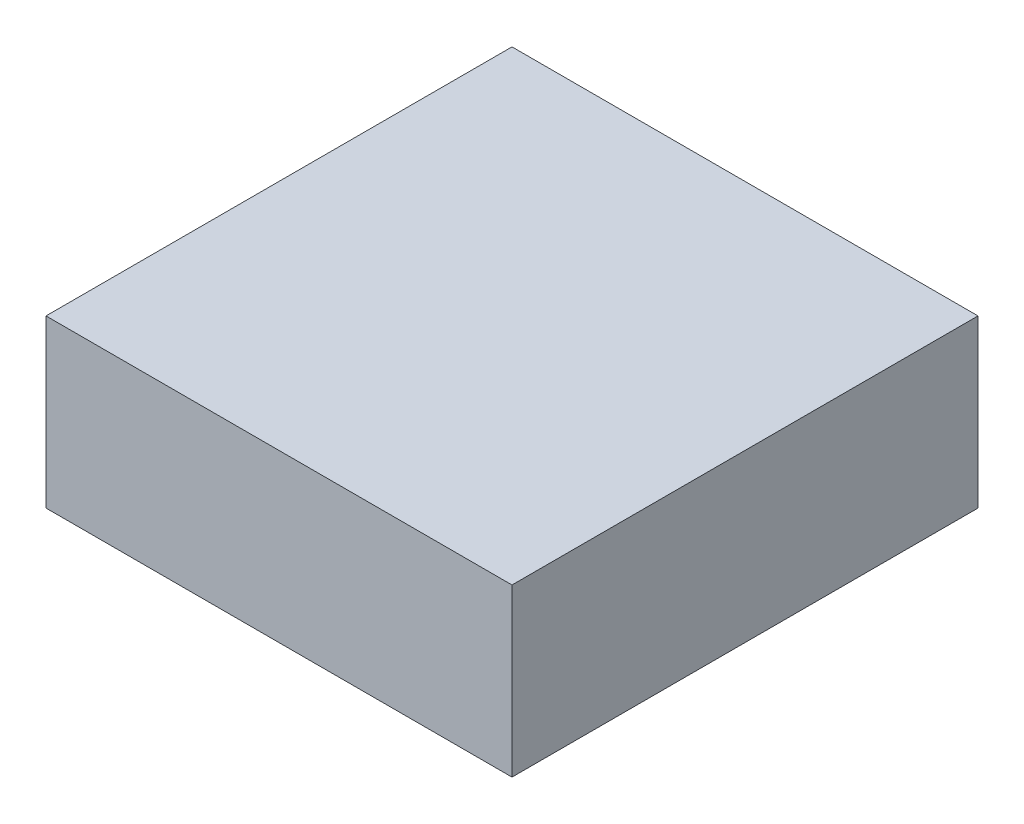
from build123d import *

# Parameters (mm, degrees)
CROQUIS1_W              = 42
CROQUIS1_H              = 42
SALIENTE_EXTRUIR1_DEPTH = 15


with BuildPart() as part:
    # Croquis1 → Saliente-Extruir1 (new body)
    with BuildSketch(Plane(origin=(0, 0, 0), x_dir=(1, 0, 0), z_dir=(0, 1, 0))):
        Rectangle(CROQUIS1_W, CROQUIS1_H)
    extrude(amount=SALIENTE_EXTRUIR1_DEPTH)


solid = part.part
